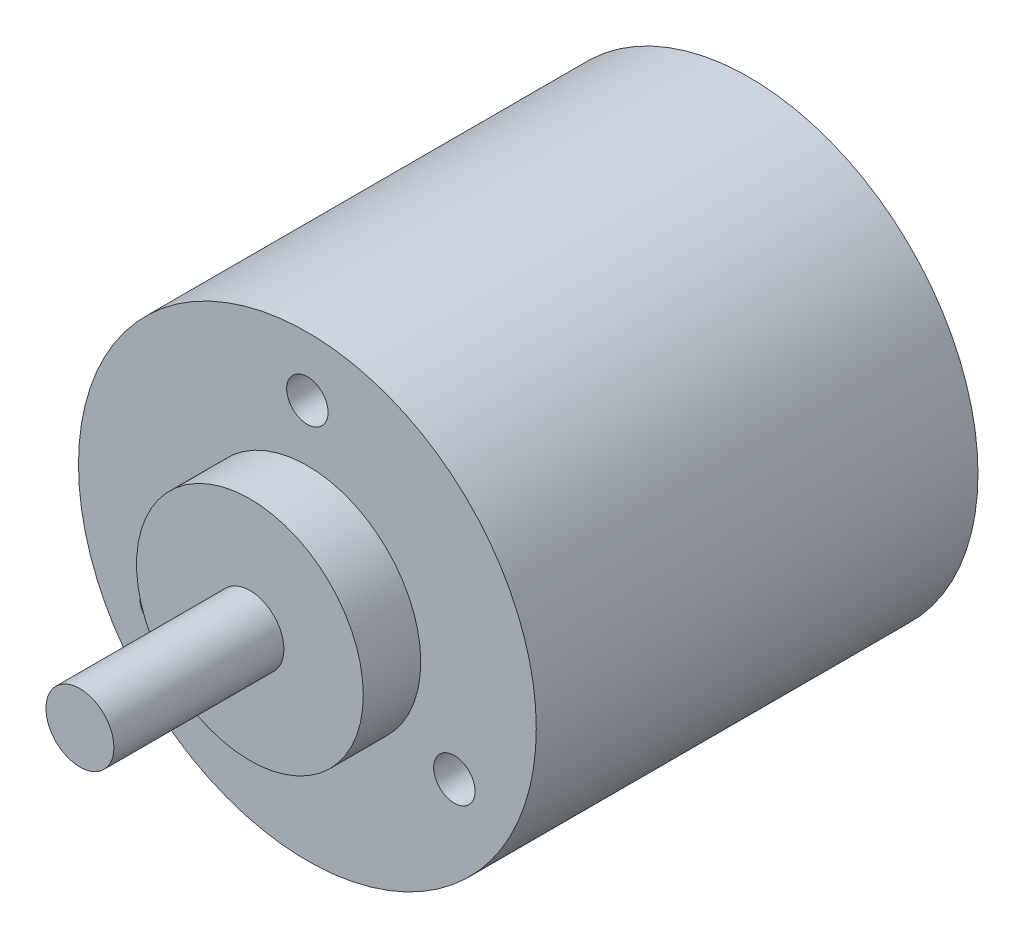
from build123d import *

# Parameters (mm, degrees)
SKETCH1_R           = 20.2311
BOSS_EXTRUDE1_DEPTH = 19.5199
SKETCH2_R           = 10.0203
BOSS_EXTRUDE2_DEPTH = 5.08
SKETCH3_R           = 3.00355
BOSS_EXTRUDE3_DEPTH = 15.0241
SKETCH4_R           = 1.8288
CUT_EXTRUDE1_DEPTH  = 7


with BuildPart() as part:
    # Sketch1 → Boss-Extrude1 (new, symmetric)
    with BuildSketch(Plane.XY):
        Circle(SKETCH1_R)
    extrude(amount=BOSS_EXTRUDE1_DEPTH, both=True)

    # Sketch2 → Boss-Extrude2 (add)
    with BuildSketch(Plane.XY.offset(19.5199)):
        Circle(SKETCH2_R)
    extrude(amount=BOSS_EXTRUDE2_DEPTH)

    # Sketch3 → Boss-Extrude3 (add)
    with BuildSketch(Plane.XY.offset(24.5999)):
        Circle(SKETCH3_R)
    extrude(amount=BOSS_EXTRUDE3_DEPTH)

    # Sketch4 → Cut-Extrude1 (cut)
    with BuildSketch(Plane.XY.offset(19.5199)):
        with Locations((0, 15)):
            Circle(SKETCH4_R)
        with Locations((12.990381057, -7.5)):
            Circle(SKETCH4_R)
        with Locations((-12.990381057, -7.5)):
            Circle(SKETCH4_R)
    extrude(amount=-CUT_EXTRUDE1_DEPTH, mode=Mode.SUBTRACT)


solid = part.part
